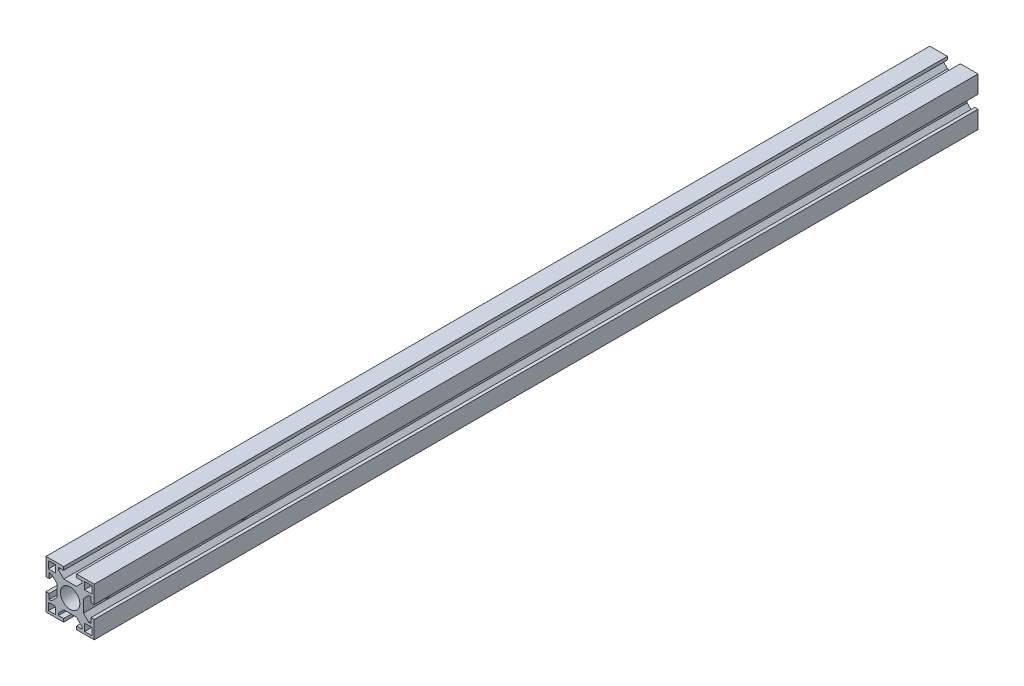
from build123d import *

# Parameters (mm, degrees)
SKIZZE1_R                       = 6.05
SKIZZE1_W                       = 4.5
SKIZZE1_H                       = 4.5
AUFSATZ_LINEAR_AUSTRAGEN1_DEPTH = 550
SKIZZE3_R                       = 3.3
SCHNITT_LINEAR_AUSTRAGEN2_DEPTH = 552.021778228


with BuildPart() as part:
    # Skizze1 → Aufsatz-Linear austragen1 (new body)
    with BuildSketch(Plane(origin=(0, 0, 0), x_dir=(-1, 0, 0), z_dir=(0, 0, -1))):
        Polygon((15.000004175, -14.999997298), (15.000004175, -3.999997298), (13.000004175, -3.999997298), (13.000004175, -7.265682298), (11.634319175, -7.265682298), (8.300003831, -3.931367382), (8.300003831, 3.931374091), (11.634315, 7.265685), (13.000004175, 7.265685), (13.000004175, 4.000002702), (15.000004175, 4.000002702), (15.000004175, 15.000002702), (4.000004175, 15.000002702), (4.000004175, 13.000002962), (7.265688438, 13.000002962), (7.265688438, 11.634318438), (3.931373306, 8.300003046), (-3.931368167, 8.300003046), (-7.265683511, 11.634317962), (-7.265683511, 13.000002962), (-3.999995825, 13.000002962), (-3.999995825, 15.000002702), (-14.999995825, 15.000002702), (-14.999995825, 4.000002702), (-12.999995825, 4.000002702), (-12.999995825, 7.265685), (-11.634315, 7.265685), (-8.3, 3.931371213), (-8.3, -3.931371213), (-11.634310825, -7.265682298), (-12.999995825, -7.265682298), (-12.999995825, -3.999997298), (-14.999995825, -3.999997298), (-14.999995825, -14.999997298), (-3.999995825, -14.999997298), (-3.999995825, -12.999997038), (-7.265683511, -12.999997038), (-7.265683511, -11.634312038), (-3.931368988, -8.299997775), (3.931373438, -8.299997775), (7.265688438, -11.634311562), (7.265688438, -12.999997038), (4.000004175, -12.999997038), (4.000004175, -14.999997298), align=None)
        Circle(SKIZZE1_R, mode=Mode.SUBTRACT)
        with Locations((11.25, 11.25)):
            Rectangle(SKIZZE1_W, SKIZZE1_H, mode=Mode.SUBTRACT)
        with Locations((11.25, -11.25)):
            Rectangle(SKIZZE1_W, SKIZZE1_H, mode=Mode.SUBTRACT)
        with Locations((-11.25, -11.25)):
            Rectangle(SKIZZE1_W, SKIZZE1_H, mode=Mode.SUBTRACT)
        with Locations((-11.25, 11.25)):
            Rectangle(SKIZZE1_W, SKIZZE1_H, mode=Mode.SUBTRACT)
    extrude(amount=-AUFSATZ_LINEAR_AUSTRAGEN1_DEPTH)

    # Skizze3 → Schnitt-Linear austragen2 (cut, through all)
    with BuildSketch(Plane.ZY.offset(15.000004175)):
        with Locations((535, 0)):
            Circle(SKIZZE3_R)
        with Locations((450, 0)):
            Circle(SKIZZE3_R)
    extrude(amount=-SCHNITT_LINEAR_AUSTRAGEN2_DEPTH, mode=Mode.SUBTRACT)


solid = part.part
